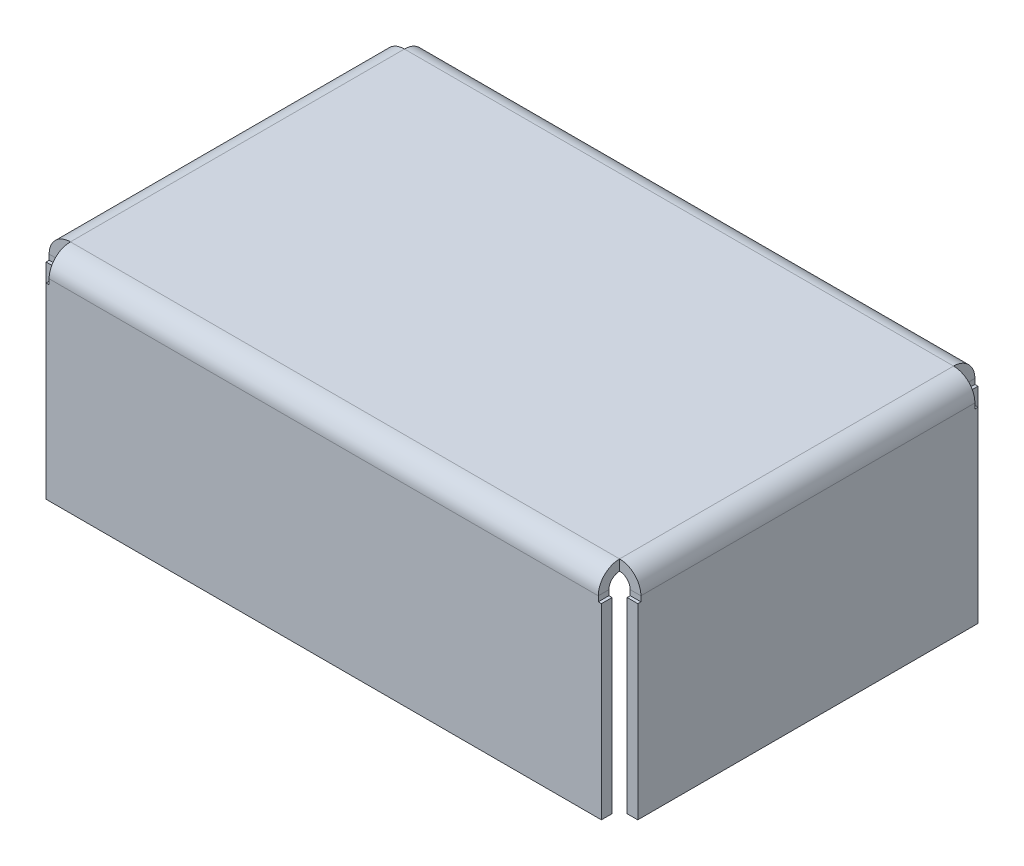
from build123d import *

# Parameters (mm, degrees)
SKETCH2_W                = 55.53941402
SKETCH2_H                = 35.345852224
BOSS_EXTRUDE1_DEPTH      = 20.066
CONVERT_SOLID10_START    = -25.769706946
CONVERT_SOLID10_DEPTH    = 51.539413892
CONVERT_SOLID10_START_2  = -29
CONVERT_SOLID10_2_DEPTH  = 58
CONVERT_SOLID10_3_DEPTH  = 58
CONVERT_SOLID10_4_DEPTH  = 2.937399826
CONVERT_SOLID10_START_3  = 26.062600174
CONVERT_SOLID10_5_DEPTH  = 2.937399826
CONVERT_SOLID10_START_4  = -26.062600174
CONVERT_SOLID10_6_DEPTH  = 0.292893228
CONVERT_SOLID10_START_5  = 25.769706946
CONVERT_SOLID10_7_DEPTH  = 0.292893228
CONVERT_SOLID10_START_6  = -15.965819276
CONVERT_SOLID10_8_DEPTH  = 31.931638552
CONVERT_SOLID10_9_DEPTH  = 0.292893228
CONVERT_SOLID10_START_7  = 15.672926048
CONVERT_SOLID10_10_DEPTH = 0.292893228


with BuildPart() as part:
    # Sketch2 → Boss-Extrude1 (new body)
    with BuildSketch(Plane(origin=(0, 0, 0), x_dir=(1, 0, 0), z_dir=(0, 1, 0))):
        Rectangle(SKETCH2_W, SKETCH2_H)
    extrude(amount=BOSS_EXTRUDE1_DEPTH)

    # Convert-Solid10: read off the stored shape, not the designer's step
    # Convert-Solid10 outline → Convert-Solid10 (cut)
    with BuildSketch(Plane.YZ.offset(CONVERT_SOLID10_START)):
        with BuildLine():
            Line((0, 16.67292608), (0, -16.67292608))
            Line((0, -16.67292608), (18.065999936, -16.67292608))
            ThreePointArc((18.065999936, -16.67292608), (18.77310674, -16.380032852), (19.065999968, -15.672926048))
            Line((19.065999968, -15.672926048), (19.065999968, 15.672926048))
            ThreePointArc((19.065999968, 15.672926048), (18.77310674, 16.380032852), (18.065999936, 16.67292608))
            Line((18.065999936, 16.67292608), (0, 16.67292608))
        make_face()
    extrude(amount=CONVERT_SOLID10_DEPTH, mode=Mode.SUBTRACT)

    # Convert-Solid10 2 outline → Convert-Solid10 2 (cut)
    with BuildSketch(Plane.YZ.offset(CONVERT_SOLID10_START_2)):
        with BuildLine():
            Line((0, 15.965819276), (17.57580092, 15.965819276))
            Line((17.57580092, 15.965819276), (17.57580092, 15.672926048))
            Line((17.57580092, 15.672926048), (19.065999968, 15.672926048))
            ThreePointArc((19.065999968, 15.672926048), (18.77310674, 16.380032852), (18.065999936, 16.67292608))
            Line((18.065999936, 16.67292608), (0, 16.67292608))
            Line((0, 16.67292608), (0, 15.965819276))
        make_face()
        with BuildLine():
            Line((17.57580092, -15.965819276), (0, -15.965819276))
            Line((0, -15.965819276), (0, -16.67292608))
            Line((0, -16.67292608), (18.065999936, -16.67292608))
            ThreePointArc((18.065999936, -16.67292608), (18.77310674, -16.380032852), (19.065999968, -15.672926048))
            Line((19.065999968, -15.672926048), (17.57580092, -15.672926048))
            Line((17.57580092, -15.672926048), (17.57580092, -15.965819276))
        make_face()
    extrude(amount=CONVERT_SOLID10_2_DEPTH, mode=Mode.SUBTRACT)

    # Convert-Solid10 3 outline → Convert-Solid10 3 (cut)
    with BuildSketch(Plane.YZ.offset(CONVERT_SOLID10_START_2)):
        with BuildLine():
            Line((20.066, 17.672926112), (18.065999936, 17.672926112))
            ThreePointArc((18.065999936, 17.672926112), (19.480213544, 17.087139656), (20.066, 15.672926048))
            Line((20.066, 15.672926048), (20.066, 17.672926112))
        make_face()
        with BuildLine():
            Line((20.066, -17.672926112), (20.066, -15.672926048))
            ThreePointArc((20.066, -15.672926048), (19.480213544, -17.087139656), (18.065999936, -17.672926112))
            Line((18.065999936, -17.672926112), (20.066, -17.672926112))
        make_face()
    extrude(amount=CONVERT_SOLID10_3_DEPTH, mode=Mode.SUBTRACT)

    # Convert-Solid10 4 outline → Convert-Solid10 4 (cut)
    with BuildSketch(Plane.YZ.offset(CONVERT_SOLID10_START_2)):
        with BuildLine():
            Line((0, 16.67292608), (18.065999936, 16.67292608))
            ThreePointArc((18.065999936, 16.67292608), (18.77310674, 16.380032852), (19.065999968, 15.672926048))
            Line((19.065999968, 15.672926048), (20.066, 15.672926048))
            ThreePointArc((20.066, 15.672926048), (19.480213544, 17.087139656), (18.065999936, 17.672926112))
            Line((18.065999936, 17.672926112), (0, 17.672926112))
            Line((0, 17.672926112), (0, 16.67292608))
        make_face()
        with BuildLine():
            ThreePointArc((18.065999936, -17.672926112), (19.480213544, -17.087139656), (20.066, -15.672926048))
            Line((20.066, -15.672926048), (19.065999968, -15.672926048))
            ThreePointArc((19.065999968, -15.672926048), (18.77310674, -16.380032852), (18.065999936, -16.67292608))
            Line((18.065999936, -16.67292608), (0, -16.67292608))
            Line((0, -16.67292608), (0, -17.672926112))
            Line((0, -17.672926112), (18.065999936, -17.672926112))
        make_face()
    extrude(amount=CONVERT_SOLID10_4_DEPTH, mode=Mode.SUBTRACT)

    # Convert-Solid10 5 outline → Convert-Solid10 5 (cut)
    with BuildSketch(Plane.YZ.offset(CONVERT_SOLID10_START_3)):
        with BuildLine():
            Line((0, 16.67292608), (18.065999936, 16.67292608))
            ThreePointArc((18.065999936, 16.67292608), (18.77310674, 16.380032852), (19.065999968, 15.672926048))
            Line((19.065999968, 15.672926048), (20.066, 15.672926048))
            ThreePointArc((20.066, 15.672926048), (19.480213544, 17.087139656), (18.065999936, 17.672926112))
            Line((18.065999936, 17.672926112), (0, 17.672926112))
            Line((0, 17.672926112), (0, 16.67292608))
        make_face()
        with BuildLine():
            ThreePointArc((18.065999936, -17.672926112), (19.480213544, -17.087139656), (20.066, -15.672926048))
            Line((20.066, -15.672926048), (19.065999968, -15.672926048))
            ThreePointArc((19.065999968, -15.672926048), (18.77310674, -16.380032852), (18.065999936, -16.67292608))
            Line((18.065999936, -16.67292608), (0, -16.67292608))
            Line((0, -16.67292608), (0, -17.672926112))
            Line((0, -17.672926112), (18.065999936, -17.672926112))
        make_face()
    extrude(amount=CONVERT_SOLID10_5_DEPTH, mode=Mode.SUBTRACT)

    # Convert-Solid10 6 outline → Convert-Solid10 6 (cut)
    with BuildSketch(Plane.YZ.offset(CONVERT_SOLID10_START_4)):
        with BuildLine():
            Line((17.57580092, 17.672926112), (17.57580092, 16.67292608))
            Line((17.57580092, 16.67292608), (18.065999936, 16.67292608))
            ThreePointArc((18.065999936, 16.67292608), (18.77310674, 16.380032852), (19.065999968, 15.672926048))
            Line((19.065999968, 15.672926048), (20.066, 15.672926048))
            ThreePointArc((20.066, 15.672926048), (19.480213544, 17.087139656), (18.065999936, 17.672926112))
            Line((18.065999936, 17.672926112), (17.57580092, 17.672926112))
        make_face()
        with BuildLine():
            ThreePointArc((18.065999936, -17.672926112), (19.480213544, -17.087139656), (20.066, -15.672926048))
            Line((20.066, -15.672926048), (19.065999968, -15.672926048))
            ThreePointArc((19.065999968, -15.672926048), (18.77310674, -16.380032852), (18.065999936, -16.67292608))
            Line((18.065999936, -16.67292608), (17.57580092, -16.67292608))
            Line((17.57580092, -16.67292608), (17.57580092, -17.672926112))
            Line((17.57580092, -17.672926112), (18.065999936, -17.672926112))
        make_face()
    extrude(amount=CONVERT_SOLID10_6_DEPTH, mode=Mode.SUBTRACT)

    # Convert-Solid10 7 outline → Convert-Solid10 7 (cut)
    with BuildSketch(Plane.YZ.offset(CONVERT_SOLID10_START_5)):
        with BuildLine():
            Line((17.57580092, 17.672926112), (17.57580092, 16.67292608))
            Line((17.57580092, 16.67292608), (18.065999936, 16.67292608))
            ThreePointArc((18.065999936, 16.67292608), (18.77310674, 16.380032852), (19.065999968, 15.672926048))
            Line((19.065999968, 15.672926048), (20.066, 15.672926048))
            ThreePointArc((20.066, 15.672926048), (19.480213544, 17.087139656), (18.065999936, 17.672926112))
            Line((18.065999936, 17.672926112), (17.57580092, 17.672926112))
        make_face()
        with BuildLine():
            ThreePointArc((18.065999936, -17.672926112), (19.480213544, -17.087139656), (20.066, -15.672926048))
            Line((20.066, -15.672926048), (19.065999968, -15.672926048))
            ThreePointArc((19.065999968, -15.672926048), (18.77310674, -16.380032852), (18.065999936, -16.67292608))
            Line((18.065999936, -16.67292608), (17.57580092, -16.67292608))
            Line((17.57580092, -16.67292608), (17.57580092, -17.672926112))
            Line((17.57580092, -17.672926112), (18.065999936, -17.672926112))
        make_face()
    extrude(amount=CONVERT_SOLID10_7_DEPTH, mode=Mode.SUBTRACT)

    # Convert-Solid10 8 outline → Convert-Solid10 8 (cut)
    with BuildSketch(Plane.XY.offset(CONVERT_SOLID10_START_6)):
        with BuildLine():
            Line((-27.76970701, 20.066), (-27.76970701, 18.065999936))
            ThreePointArc((-27.76970701, 18.065999936), (-27.183920554, 19.480213544), (-25.769706946, 20.066))
            Line((-25.769706946, 20.066), (-27.76970701, 20.066))
        make_face()
        with BuildLine():
            Line((27.76970701, 20.066), (25.769706946, 20.066))
            ThreePointArc((25.769706946, 20.066), (27.183920554, 19.480213544), (27.76970701, 18.065999936))
            Line((27.76970701, 18.065999936), (27.76970701, 20.066))
        make_face()
        with BuildLine():
            ThreePointArc((-25.769706946, 19.065999968), (-26.47681375, 18.77310674), (-26.769706978, 18.065999936))
            Line((-26.769706978, 18.065999936), (-26.769706978, 0))
            Line((-26.769706978, 0), (-25.769706946, 0))
            Line((-25.769706946, 0), (-25.769706946, 19.065999968))
        make_face()
        with BuildLine():
            ThreePointArc((26.769706978, 18.065999936), (26.47681375, 18.77310674), (25.769706946, 19.065999968))
            Line((25.769706946, 19.065999968), (25.769706946, 0))
            Line((25.769706946, 0), (26.769706978, 0))
            Line((26.769706978, 0), (26.769706978, 18.065999936))
        make_face()
    extrude(amount=CONVERT_SOLID10_8_DEPTH, mode=Mode.SUBTRACT)

    # Convert-Solid10 9 outline → Convert-Solid10 9 (cut)
    with BuildSketch(Plane.XY.offset(CONVERT_SOLID10_START_6)):
        with BuildLine():
            ThreePointArc((-25.769706946, 20.066), (-27.183920554, 19.480213544), (-27.76970701, 18.065999936))
            Line((-27.76970701, 18.065999936), (-27.76970701, 17.57580092))
            Line((-27.76970701, 17.57580092), (-26.769706978, 17.57580092))
            Line((-26.769706978, 17.57580092), (-26.769706978, 18.065999936))
            ThreePointArc((-26.769706978, 18.065999936), (-26.47681375, 18.77310674), (-25.769706946, 19.065999968))
            Line((-25.769706946, 19.065999968), (-25.769706946, 20.066))
        make_face()
        with BuildLine():
            ThreePointArc((27.76970701, 18.065999936), (27.183920554, 19.480213544), (25.769706946, 20.066))
            Line((25.769706946, 20.066), (25.769706946, 19.065999968))
            ThreePointArc((25.769706946, 19.065999968), (26.47681375, 18.77310674), (26.769706978, 18.065999936))
            Line((26.769706978, 18.065999936), (26.769706978, 17.57580092))
            Line((26.769706978, 17.57580092), (27.76970701, 17.57580092))
            Line((27.76970701, 17.57580092), (27.76970701, 18.065999936))
        make_face()
    extrude(amount=CONVERT_SOLID10_9_DEPTH, mode=Mode.SUBTRACT)

    # Convert-Solid10 10 outline → Convert-Solid10 10 (cut)
    with BuildSketch(Plane.XY.offset(CONVERT_SOLID10_START_7)):
        with BuildLine():
            ThreePointArc((-25.769706946, 20.066), (-27.183920554, 19.480213544), (-27.76970701, 18.065999936))
            Line((-27.76970701, 18.065999936), (-27.76970701, 17.57580092))
            Line((-27.76970701, 17.57580092), (-26.769706978, 17.57580092))
            Line((-26.769706978, 17.57580092), (-26.769706978, 18.065999936))
            ThreePointArc((-26.769706978, 18.065999936), (-26.47681375, 18.77310674), (-25.769706946, 19.065999968))
            Line((-25.769706946, 19.065999968), (-25.769706946, 20.066))
        make_face()
        with BuildLine():
            ThreePointArc((27.76970701, 18.065999936), (27.183920554, 19.480213544), (25.769706946, 20.066))
            Line((25.769706946, 20.066), (25.769706946, 19.065999968))
            ThreePointArc((25.769706946, 19.065999968), (26.47681375, 18.77310674), (26.769706978, 18.065999936))
            Line((26.769706978, 18.065999936), (26.769706978, 17.57580092))
            Line((26.769706978, 17.57580092), (27.76970701, 17.57580092))
            Line((27.76970701, 17.57580092), (27.76970701, 18.065999936))
        make_face()
    extrude(amount=CONVERT_SOLID10_10_DEPTH, mode=Mode.SUBTRACT)


solid = part.part
